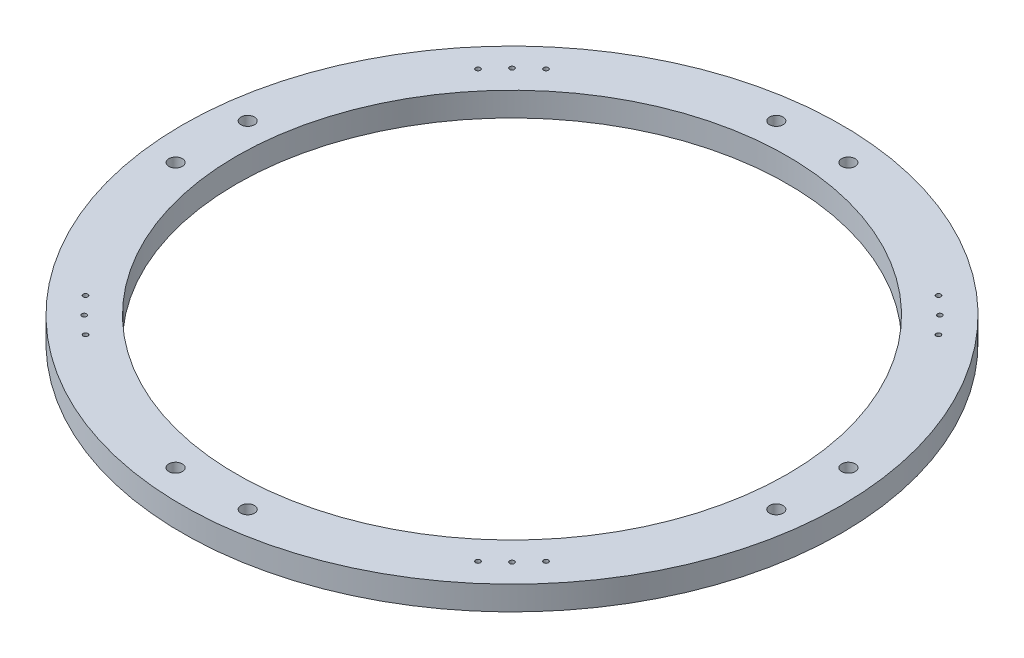
from build123d import *

# Parameters (mm, degrees)
SKETCH1_W                   = 28.575
SKETCH1_H                   = 12.7
TAP_DRILL_FOR_M3X0_5_TAP1_D = 2.5
SKETCH7_R                   = 3.571875
CUT_EXTRUDE1_DEPTH          = 247.543645639
CIRPATTERN1_COUNT           = 4


with BuildPart() as part:
    # Sketch1 → Revolve1 (revolve)
    with BuildSketch(Plane.XY):
        with Locations((159.813733777, 203.050503093)):
            Rectangle(SKETCH1_W, SKETCH1_H)
    revolve(axis=Axis((1e-09, -200000, 0), (0, 1, 0)))

    # Tap Drill for M3x0.5 Tap1 (through all)
    with Locations(Plane(origin=(0, 209.400503093, 0), x_dir=(1, 0, 0), z_dir=(0, 1, 0))):
        with Locations((-113.00537488, 113.00537488), (-103.667734326, 121.628246568), (-121.628246568, 103.667734326)):
            tap_drill_for_m3x0_5_tap1 = Hole(TAP_DRILL_FOR_M3X0_5_TAP1_D / 2)

    # Sketch7 → Cut-Extrude1 (cut, through all)
    with BuildSketch(Plane(origin=(0, 209.400503093, 0), x_dir=(1, 0, 0), z_dir=(0, 1, 0))):
        with Locations((158.674245572, -19.05)):
            Circle(SKETCH7_R)
        with Locations((158.674245572, 19.05)):
            Circle(SKETCH7_R)
    cut_extrude1 = extrude(amount=-CUT_EXTRUDE1_DEPTH, mode=Mode.SUBTRACT)

    # CirPattern1: Tap Drill for M3x0.5 Tap1, Cut-Extrude1 ×4 about axis
    cirpattern1_axis = Axis((1e-09, -200000, 0), (0, -1, 0))
    add([tap_drill_for_m3x0_5_tap1.rotate(cirpattern1_axis, i * 360 / CIRPATTERN1_COUNT) for i in range(1, CIRPATTERN1_COUNT)], mode=Mode.SUBTRACT)
    add([cut_extrude1.rotate(cirpattern1_axis, i * 360 / CIRPATTERN1_COUNT) for i in range(1, CIRPATTERN1_COUNT)], mode=Mode.SUBTRACT)


solid = part.part
